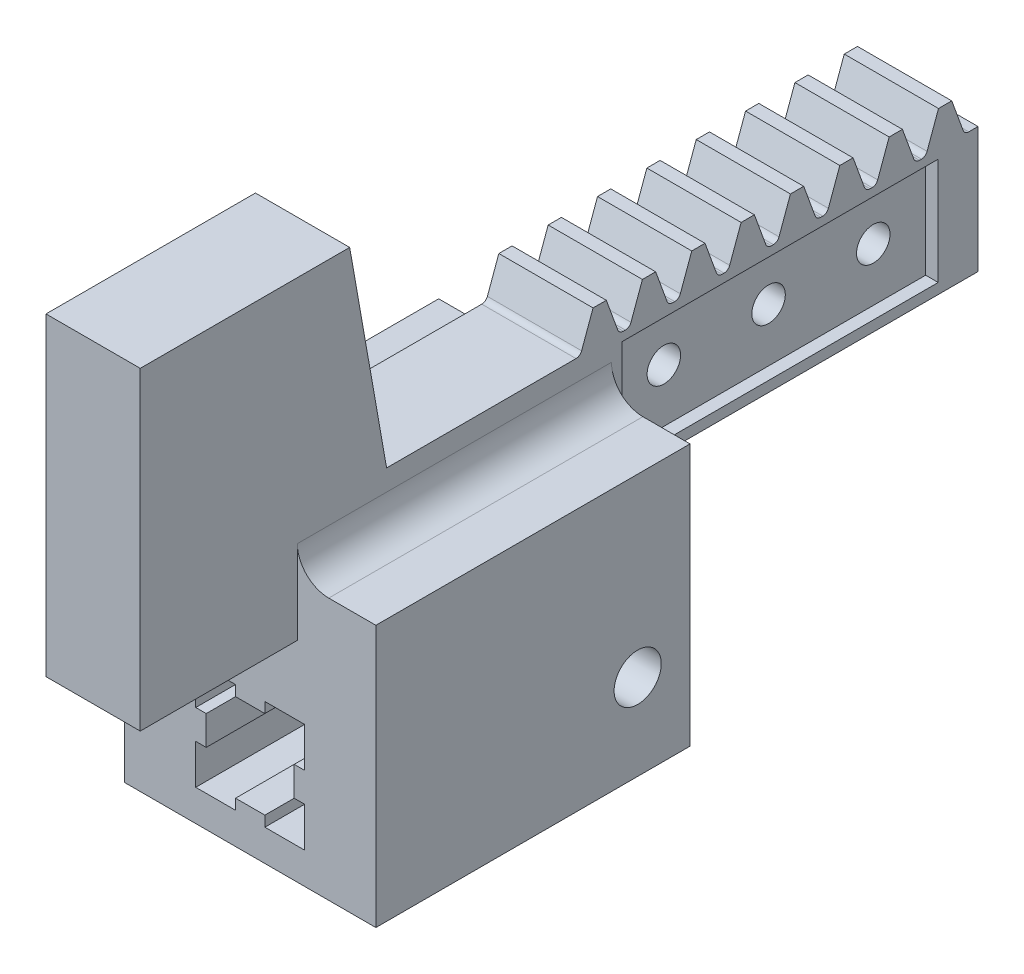
from build123d import *

# Parameters (mm, degrees)
ESQUISSE1_W                      = 24
ESQUISSE1_H                      = 25
MAIN_EXTRUSION_DEPTH             = 30
MAIN_RIDING_HOLE_DEPTH           = 35.644624403
ESQUISSE4_R                      = 2.25
TRACTORHOLE_DEPTH                = 8
IMPACTPIECE_DEPTH                = 4.5
CONG_1_R                         = 3
BOSS_EXTRU_1_DEPTH               = 4.5
CONG_3_R                         = 0.57
R_P_TITION_LIN_AIRE1_COUNT       = 8
R_P_TITION_LIN_AIRE1_PITCH       = 4.71238898
CONG_3_OF_R_P_TITION_LIN_AIRE1_R = 0.57
ESQUISSE9_W                      = 30.2
ESQUISSE9_H                      = 10.2
ENL_V_MAT_EXTRU_1_DEPTH          = 1.2
ESQUISSE10_R                     = 1.6
ENL_V_MAT_EXTRU_2_DEPTH          = 61.542051501
R_P_TITION_LIN_AIRE2_COUNT       = 3
R_P_TITION_LIN_AIRE2_PITCH       = 10
ESQUISSE11_W                     = 7.5
ESQUISSE11_H                     = 5
ENL_V_MAT_EXTRU_3_DEPTH          = 20


with BuildPart() as part:
    # Esquisse1 → Main Extrusion (new body)
    with BuildSketch(Plane.XY):
        Rectangle(ESQUISSE1_W, ESQUISSE1_H)
    extrude(amount=MAIN_EXTRUSION_DEPTH)

    # Esquisse3 → Main Riding Hole (cut, through all)
    with BuildSketch(Plane(origin=(0, 0, 0), x_dir=(-1, 0, 0), z_dir=(0, 0, -1))):
        Polygon((-5.2, 0.9), (-5.2, -2.9), (-4.2, -2.9), (-4.2, -5.7), (-5.2, -5.7), (-5.2, -9.5), (-1.4, -9.5), (-1.4, -8.5), (1.4, -8.5), (1.4, -9.5), (5.2, -9.5), (5.2, -5.7), (4.2, -5.7), (4.2, -2.9), (5.2, -2.9), (5.2, 0.9), (1.4, 0.9), (1.4, -0.1), (-1.4, -0.1), (-1.4, 0.9), align=None)
    extrude(amount=-MAIN_RIDING_HOLE_DEPTH, mode=Mode.SUBTRACT)

    # Esquisse4 → TractorHole (cut)
    with BuildSketch(Plane.ZY.offset(12)):
        with Locations((5, -4.3)):
            Circle(ESQUISSE4_R)
    tractorhole = extrude(amount=-TRACTORHOLE_DEPTH, mode=Mode.SUBTRACT)

    # TractorHoleSymetry: TractorHole across plane
    add(tractorhole.mirror(Plane(origin=(0, 0, 0), x_dir=(0, 0, 1), z_dir=(1, 0, 0))), mode=Mode.SUBTRACT)

    # Esquisse5 → ImpactPiece (add, symmetric)
    with BuildSketch(Plane(origin=(0, 0, 0), x_dir=(0, 0, -1), z_dir=(1, 0, 0))):
        Polygon((-45, 7.5), (-45, 37.5), (-25, 37.5), (-21.473460386, 17.5), (35, 17.5), (35, 5.5), (0, 5.5), (0, 7.5), align=None)
    extrude(amount=IMPACTPIECE_DEPTH, both=True)

    # Congé1
    cong_1_edges = [part.edges().sort_by_distance(p)[0] for p in [
        (-4.5, 12.5, 15),
        (4.5, 12.5, 15),
    ]]
    fillet(cong_1_edges, radius=CONG_1_R)

    # Esquisse8 → Boss.-Extru.1 (add, symmetric)
    with BuildSketch(Plane(origin=(0, 0, 0), x_dir=(0, 0, -1), z_dir=(1, 0, 0))):
        Polygon((30, 17.5), (31.228399541, 20.875), (32.492683328, 20.875), (33.721082869, 17.5), align=None)
    boss_extru_1 = extrude(amount=BOSS_EXTRU_1_DEPTH, both=True)

    # Congé3
    cong_3_edges = [part.edges().sort_by_distance(p)[0] for p in [
        (0, 17.5, -30),
        (0, 17.5, -33.721082869),
    ]]
    fillet(cong_3_edges, radius=CONG_3_R)

    # Répétition linéaire1: Boss.-Extru.1 ×8
    with Locations(*[(0, 0, i * R_P_TITION_LIN_AIRE1_PITCH) for i in range(1, R_P_TITION_LIN_AIRE1_COUNT)]):
        add(boss_extru_1)

    # Congé3 of Répétition linéaire1
    cong_3_of_r_p_tition_lin_aire1_edges = [part.edges().sort_by_distance(p)[0] for p in [
        (0, 17.5, -25.28761102),
        (0, 17.5, -29.008693889),
        (0, 17.5, -20.57522204),
        (0, 17.5, -24.296304909),
        (0, 17.5, -15.86283306),
        (0, 17.5, -19.583915929),
        (0, 17.5, -11.15044408),
        (0, 17.5, -14.871526949),
        (0, 17.5, -6.4380551),
        (0, 17.5, -10.159137969),
        (0, 17.5, -1.72566612),
        (0, 17.5, -5.446748989),
        (0, 17.5, 2.98672286),
        (0, 17.5, -0.734360009),
    ]]
    fillet(cong_3_of_r_p_tition_lin_aire1_edges, radius=CONG_3_OF_R_P_TITION_LIN_AIRE1_R)

    # Esquisse9 → Enlèv. mat.-Extru.1 (cut)
    with BuildSketch(Plane(origin=(4.5, 0, 0), x_dir=(0, 0, -1), z_dir=(1, 0, 0))):
        with Locations((16.1, 11.6)):
            Rectangle(ESQUISSE9_W, ESQUISSE9_H)
    enl_v_mat_extru_1 = extrude(amount=-ENL_V_MAT_EXTRU_1_DEPTH, mode=Mode.SUBTRACT)

    # Esquisse10 → Enlèv. mat.-Extru.2 (cut, through all)
    with BuildSketch(Plane(origin=(3.3, 0, 0), x_dir=(0, 0, -1), z_dir=(1, 0, 0))):
        with Locations((26.2, 11.6)):
            Circle(ESQUISSE10_R)
    enl_v_mat_extru_2 = extrude(amount=-ENL_V_MAT_EXTRU_2_DEPTH, mode=Mode.SUBTRACT)

    # Répétition linéaire2: Enlèv. mat.-Extru.2 ×3
    with Locations(*[(0, 0, i * R_P_TITION_LIN_AIRE2_PITCH) for i in range(1, R_P_TITION_LIN_AIRE2_COUNT)]):
        add(enl_v_mat_extru_2, mode=Mode.SUBTRACT)

    # Symétrie1: Enlèv. mat.-Extru.1 across plane
    add(enl_v_mat_extru_1.mirror(Plane(origin=(0, 0, 0), x_dir=(0, 0, 1), z_dir=(1, 0, 0))), mode=Mode.SUBTRACT)

    # Esquisse11 → Enlèv. mat.-Extru.3 (cut)
    with BuildSketch(Plane(origin=(0, 0, 0), x_dir=(-1, 0, 0), z_dir=(0, 0, -1))):
        with Locations((8.25, 4.4)):
            Rectangle(ESQUISSE11_W, ESQUISSE11_H)
    extrude(amount=-ENL_V_MAT_EXTRU_3_DEPTH, mode=Mode.SUBTRACT)


solid = part.part
